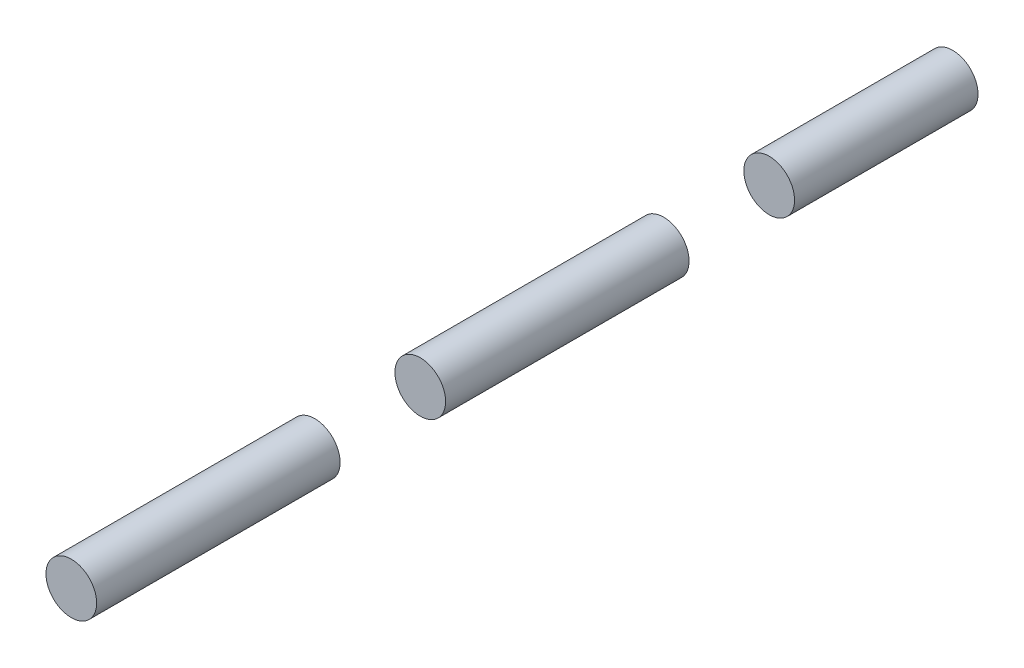
from build123d import *

# Parameters (mm, degrees)
BOSS_EXTRUDE1_START     = -60.96
BOSS_EXTRUDE1_OUTLINE_R = 6.35
BOSS_EXTRUDE1_DEPTH     = 60.96
SKETCH3_R               = 6.35
BOSS_EXTRUDE2_DEPTH     = 60.96
SKETCH4_R               = 6.35
BOSS_EXTRUDE3_DEPTH     = 45.946272956


# Read off the part's stored shape, not the designer's step: Boss-Extrude1
with BuildPart() as part:
    # Boss-Extrude1 outline → Boss-Extrude1 (new body)
    with BuildSketch(Plane.XY.offset(197.838272956).offset(BOSS_EXTRUDE1_START)):
        with Locations((42.968393667, -48.101963299)):
            Circle(BOSS_EXTRUDE1_OUTLINE_R)
    extrude(amount=BOSS_EXTRUDE1_DEPTH)


with BuildPart() as body_2:
    # Sketch3 → Boss-Extrude2 (new body)
    with BuildSketch(Plane.XY.offset(110.462272956)):
        with Locations((42.968393667, -48.101963299)):
            Circle(SKETCH3_R)
    extrude(amount=-BOSS_EXTRUDE2_DEPTH)


with BuildPart() as body_3:
    # Sketch4 → Boss-Extrude3 (new body)
    with BuildSketch(Plane(origin=(0, 0, 23.086272956), x_dir=(-1, 0, 0), z_dir=(0, 0, -1))):
        with Locations((-42.968393667, -48.101963299)):
            Circle(SKETCH4_R)
    extrude(amount=BOSS_EXTRUDE3_DEPTH)


solid = Compound([part.part, body_2.part, body_3.part])
